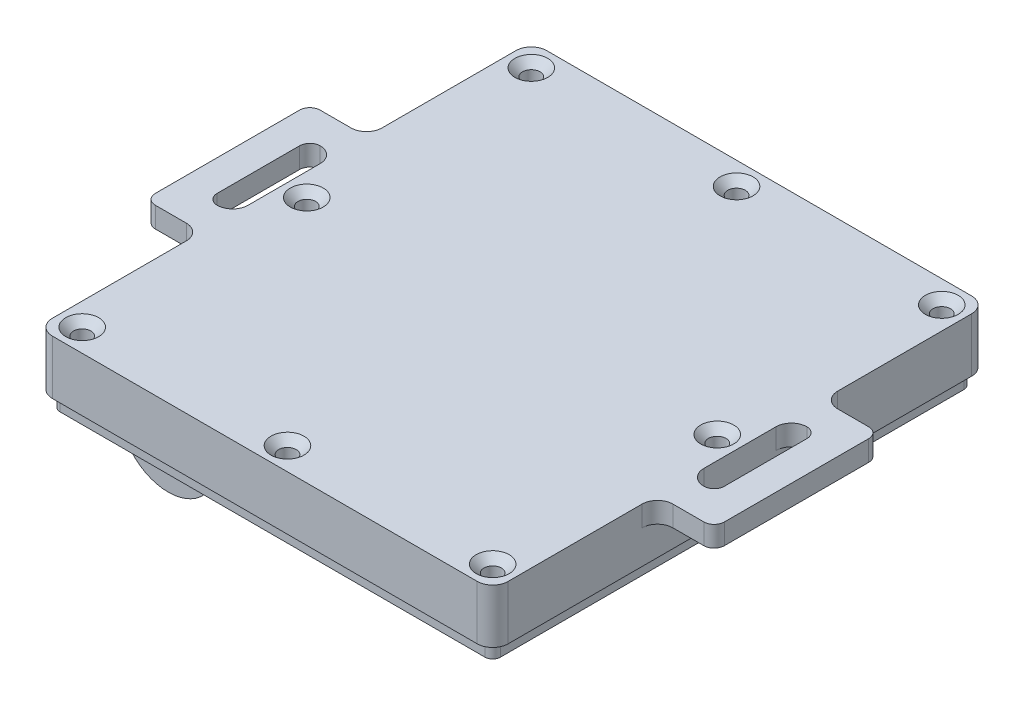
from build123d import *

# Parameters (mm, degrees)
SKETCH_1_W            = 88.5
SKETCH_1_H            = 96
SKETCH_1_W_2          = 51.5
SKETCH_1_H_2          = 70.5
SKETCH_1_W_3          = 19
SKETCH_1_H_3          = 71
EXTRUDE_1_DEPTH       = 9.5
SKETCH_5_W            = 88.5
SKETCH_5_H            = 96
EXTRUDE_4_DEPTH       = 4
SKETCH_6_W            = 51.5
SKETCH_6_H            = 1
EXTRUDE_6_DEPTH       = 4
FILLET_3_R            = 9.5
SKETCH_7_W            = 8
SKETCH_7_H            = 9.5
SKETCH_7_W_2          = 37
SKETCH_7_H_2          = 1.5
CUT_EXTRUDE_1_DEPTH   = 4.5
SKETCH_8_W            = 2.5
SKETCH_8_H            = 30
CUT_EXTRUDE_2_DEPTH   = 5.5
SKETCH_9_W            = 19
SKETCH_9_H            = 4.5
EXTRUDE_7_DEPTH       = 9.5
FILLET_4_R            = 9.5
CUT_EXTRUDE_3_DEPTH   = 2.5
SKETCH_11_R           = 3.75
CUT_EXTRUDE_4_DEPTH   = 2.5
SKETCH_13_R           = 1.7
CUT_EXTRUDE_5_DEPTH   = 73.573120111
SKETCH_14_R           = 1.7
CUT_EXTRUDE_6_DEPTH   = 73.573120111
CHAMFER_1_SIZE        = 1.5
SKETCH_15_W           = 6
SKETCH_15_H           = 71
CUT_EXTRUDE_7_DEPTH   = 9.5
CUT_EXTRUDE_9_REACH   = 82.165
SKETCH_18_W           = 2.9
SKETCH_18_H           = 7.825684219
CUT_EXTRUDE_10_DEPTH  = 2.5
SKETCH_19_W           = 3.75
SKETCH_19_H           = 9.5
CUT_EXTRUDE_11_DEPTH  = 2.5
FILLET_5_R            = 3
CUT_EXTRUDE_2_2_DEPTH = 3
EXTRUDE_8_DEPTH       = 4
FILLET_6_R            = 3


with BuildPart() as part:
    # Эскиз1 → Бобышка-Вытянуть1 (new body)
    with BuildSketch(Plane(origin=(0, 0, 0), x_dir=(1, 0, 0), z_dir=(0, 1, 0))):
        with Locations((-4.541472233, 4)):
            Rectangle(SKETCH_1_W, SKETCH_1_H)
        with Locations((5.958527767, -0.75)):
            Rectangle(SKETCH_1_W_2, SKETCH_1_H_2, mode=Mode.SUBTRACT)
        with Locations((-31.291472233, 4)):
            Rectangle(SKETCH_1_W_3, SKETCH_1_H_3, mode=Mode.SUBTRACT)
    extrude(amount=EXTRUDE_1_DEPTH)

    # Эскиз5 → Бобышка-Вытянуть4 (add)
    with BuildSketch(Plane(origin=(0, 9.5, 0), x_dir=(1, 0, 0), z_dir=(0, 1, 0))):
        with Locations((-4.541472233, 4)):
            Rectangle(SKETCH_5_W, SKETCH_5_H)
    extrude(amount=EXTRUDE_4_DEPTH)

    # Эскиз6 → Бобышка-Вытянуть6 (add)
    with BuildSketch(Plane.XZ.offset(-9.5)):
        with Locations((5.958527767, 35.5)):
            Rectangle(SKETCH_6_W, SKETCH_6_H)
        with Locations((5.958527767, -34)):
            Rectangle(SKETCH_6_W, SKETCH_6_H)
    extrude(amount=EXTRUDE_6_DEPTH)

    # Скругление3
    fillet_3_edges = [part.edges().sort_by_distance(p)[0] for p in [
        (-40.791472233, 9.5, -4),
        (-21.791472233, 9.5, -4),
    ]]
    fillet(fillet_3_edges, radius=FILLET_3_R - 0.0001)  # a hair under: the kernel refuses the full size

    # Эскиз7 → Вырез-Вытянуть1 (cut)
    with BuildSketch(Plane.XZ):
        with Locations((27.708527767, -39.25)):
            Rectangle(SKETCH_7_W, SKETCH_7_H)
        with Locations((-1.291472233, -35.25)):
            Rectangle(SKETCH_7_W_2, SKETCH_7_H_2)
    extrude(amount=-CUT_EXTRUDE_1_DEPTH, mode=Mode.SUBTRACT)

    # Эскиз8 → Cut-Extrude 2 (cut)
    with BuildSketch(Plane.XZ):
        with Locations((32.958527767, 21)):
            Rectangle(SKETCH_8_W, SKETCH_8_H)
    extrude(amount=-CUT_EXTRUDE_2_DEPTH, mode=Mode.SUBTRACT)

    # Эскиз9 → Бобышка-Вытянуть7 (add)
    with BuildSketch(Plane.XZ):
        with Locations((-31.291472233, 33.75)):
            Rectangle(SKETCH_9_W, SKETCH_9_H)
        with Locations((-31.291472233, -41.75)):
            Rectangle(SKETCH_9_W, SKETCH_9_H)
    extrude(amount=EXTRUDE_7_DEPTH)

    # Скругление4
    fillet_4_edges = [part.edges().sort_by_distance(p)[0] for p in [
        (-21.791472233, -9.5, 33.75),
        (-21.791472233, -9.5, -41.75),
        (-40.791472233, -9.5, -41.75),
        (-40.791472233, -9.5, 33.75),
    ]]
    fillet(fillet_4_edges, radius=FILLET_4_R - 0.0001)  # a hair under: the kernel refuses the full size

    # Эскиз10 → Вырез-Вытянуть3 (cut)
    with BuildSketch(Plane(origin=(0, 0, 31.5), x_dir=(-1, 0, 0), z_dir=(0, 0, -1))):
        Polygon((31.291472233, 3.348631561), (28.391472233, 1.674315781), (28.391472233, -1.674315781), (31.291472233, -3.348631561), (34.191472233, -1.674315781), (34.191472233, 1.674315781), align=None)
    extrude(amount=-CUT_EXTRUDE_3_DEPTH, mode=Mode.SUBTRACT)

    # Эскиз11 → Вырез-Вытянуть4 (cut)
    with BuildSketch(Plane.XY.offset(-39.5)):
        with Locations((-31.291472233, 0)):
            Circle(SKETCH_11_R)
    extrude(amount=-CUT_EXTRUDE_4_DEPTH, mode=Mode.SUBTRACT)

    # Эскиз13 → Вырез-Вытянуть5 (cut, through all)
    with BuildSketch(Plane.XZ):
        with Locations(Location((35.308527767, 39.6, 0), (0, 0, 90))):
            Circle(SKETCH_13_R)
        with Locations(Location((-44.391472233, 39.6, 0), (0, 0, 270))):
            Circle(SKETCH_13_R)
        with Locations(Location((-44.391472233, -47.6, 0), (0, 0, 90))):
            Circle(SKETCH_13_R)
        with Locations(Location((35.308527767, -47.6, 0), (0, 0, 270))):
            Circle(SKETCH_13_R)
    extrude(amount=-CUT_EXTRUDE_5_DEPTH, mode=Mode.SUBTRACT)

    # Эскиз14 → Вырез-Вытянуть6 (cut, through all)
    with BuildSketch(Plane.XZ):
        with Locations(Location((-4.541472233, -47.6, 0), (0, 0, 270))):
            Circle(SKETCH_14_R)
        with Locations(Location((-4.541472233, 39.6, 0), (0, 0, 90))):
            Circle(SKETCH_14_R)
        with Locations(Location((-44.391472233, -4, 0), (0, 0, 270))):
            Circle(SKETCH_14_R)
        with Locations(Location((35.308527767, -4, 0), (0, 0, 90))):
            Circle(SKETCH_14_R)
    extrude(amount=-CUT_EXTRUDE_6_DEPTH, mode=Mode.SUBTRACT)

    # Фаска1
    chamfer_1_edges = [part.edges().sort_by_distance(p)[0] for p in [
        (-44.391472233, 13.5, 41.3),
        (35.308527767, 13.5, 37.9),
        (-44.391472233, 13.5, -49.3),
        (35.308527767, 13.5, -45.9),
        (-4.541472233, 13.5, -45.9),
        (-4.541472233, 13.5, 37.9),
        (-44.391472233, 13.5, -2.3),
        (35.308527767, 13.5, -5.7),
    ]]
    chamfer(chamfer_1_edges, length=CHAMFER_1_SIZE)

    # Эскиз15 → Вырез-Вытянуть7 (cut)
    with BuildSketch(Plane.XZ):
        with Locations((-28.291472233, -4)):
            Rectangle(SKETCH_15_W, SKETCH_15_H)
    extrude(amount=-CUT_EXTRUDE_7_DEPTH, mode=Mode.SUBTRACT)

    # Вырез-Вытянуть9: up to this face of the body (flat: up to its plane)
    cut_extrude_9_end = Plane(part.part.faces().sort_by_distance((-25.291472233, 8.432756206, -4))[0])
    # Эскиз17 → Вырез-Вытянуть9 (cut, up to the picked face)
    with BuildSketch(Plane(origin=(-19.791472233, 0, 0), x_dir=(0, 0, -1), z_dir=(1, 0, 0)), mode=Mode.PRIVATE) as cut_extrude_9_sk1:
        with BuildLine():
            Line((-31.5, 9.5), (-26.5, 9.5))
            Line((-26.5, 9.5), (-26.5, 6.283345014))
            ThreePointArc((-26.5, 6.283345014), (-27.085786438, 4.869131452), (-28.5, 4.283345014))
            Line((-28.5, 4.283345014), (-29.5, 4.283345014))
            ThreePointArc((-29.5, 4.283345014), (-30.914213562, 4.869131452), (-31.5, 6.283345014))
            Line((-31.5, 6.283345014), (-31.5, 9.5))
        make_face()
    cut_extrude_9_tool1 = split(extrude(cut_extrude_9_sk1.sketch, amount=-CUT_EXTRUDE_9_REACH, mode=Mode.PRIVATE), bisect_by=cut_extrude_9_end, keep=Keep.BOTH, mode=Mode.PRIVATE)
    add(cut_extrude_9_tool1.solids().sort_by(Axis((-19.791472, 7.043974, 29), (-1, 0, 0)))[0], mode=Mode.SUBTRACT)

    # Эскиз18 → Вырез-Вытянуть10 (cut)
    with BuildSketch(Plane(origin=(0, 0, 31.5), x_dir=(-1, 0, 0), z_dir=(0, 0, -1))):
        with Locations((29.841472233, 5.587157891)):
            Rectangle(SKETCH_18_W, SKETCH_18_H)
    extrude(amount=-CUT_EXTRUDE_10_DEPTH, mode=Mode.SUBTRACT)

    # Эскиз19 → Вырез-Вытянуть11 (cut)
    with BuildSketch(Plane.XY.offset(-39.5)):
        with Locations((-29.416472233, 4.75)):
            Rectangle(SKETCH_19_W, SKETCH_19_H)
    extrude(amount=-CUT_EXTRUDE_11_DEPTH, mode=Mode.SUBTRACT)

    # Скругление5
    fillet_5_edges = [part.edges().sort_by_distance(p)[0] for p in [
        (-48.791472233, 6.75, -52),
        (39.708527767, 6.75, -52),
        (39.708527767, 6.75, 44),
        (-48.791472233, 6.75, 44),
    ]]
    fillet(fillet_5_edges, radius=FILLET_5_R)

    # Эскиз21 → Cut-Extrude 2 2 (cut)
    with BuildSketch(Plane.XZ):
        with BuildLine():
            Line((-48.791472233, -49), (-48.791472233, 41))
            ThreePointArc((-48.791472233, 41), (-47.912792577, 43.121320344), (-45.791472233, 44))
            Line((-45.791472233, 44), (36.708527767, 44))
            ThreePointArc((36.708527767, 44), (38.82984811, 43.121320344), (39.708527767, 41))
            Line((39.708527767, 41), (39.708527767, -49))
            ThreePointArc((39.708527767, -49), (38.82984811, -51.121320344), (36.708527767, -52))
            Line((36.708527767, -52), (-45.791472233, -52))
            ThreePointArc((-45.791472233, -52), (-47.912792577, -51.121320344), (-48.791472233, -49))
        make_face()
        with BuildLine():
            Line((-47.291472233, -49), (-47.291472233, 41))
            ThreePointArc((-47.291472233, 41), (-46.852132405, 42.060660172), (-45.791472233, 42.5))
            Line((-45.791472233, 42.5), (36.708527767, 42.5))
            ThreePointArc((36.708527767, 42.5), (37.769187939, 42.060660172), (38.208527767, 41))
            Line((38.208527767, 41), (38.208527767, -49))
            ThreePointArc((38.208527767, -49), (37.769187939, -50.060660172), (36.708527767, -50.5))
            Line((36.708527767, -50.5), (-45.791472233, -50.5))
            ThreePointArc((-45.791472233, -50.5), (-46.852132405, -50.060660172), (-47.291472233, -49))
        make_face(mode=Mode.SUBTRACT)
    extrude(amount=-CUT_EXTRUDE_2_2_DEPTH, mode=Mode.SUBTRACT)

    # Эскиз22 → Бобышка-Вытянуть8 (add)
    with BuildSketch(Plane(origin=(0, 13.5, 0), x_dir=(1, 0, 0), z_dir=(0, 1, 0))):
        with BuildLine():
            Line((-48.791472233, -6), (-51.791472233, -6))
            ThreePointArc((-51.791472233, -6), (-53.205685795, -5.414213562), (-53.791472233, -4))
            Line((-53.791472233, -4), (-53.791472233, 12))
            ThreePointArc((-53.791472233, 12), (-53.205685795, 13.414213562), (-51.791472233, 14))
            Line((-51.791472233, 14), (-48.791472233, 14))
            Line((-48.791472233, 14), (-48.791472233, 20))
            Line((-48.791472233, 20), (-57.791472233, 20))
            ThreePointArc((-57.791472233, 20), (-59.205685795, 19.414213562), (-59.791472233, 18))
            Line((-59.791472233, 18), (-59.791472233, -10))
            ThreePointArc((-59.791472233, -10), (-59.205685795, -11.414213562), (-57.791472233, -12))
            Line((-57.791472233, -12), (-48.791472233, -12))
            Line((-48.791472233, -12), (-48.791472233, -6))
        make_face()
        with BuildLine():
            Line((39.708527767, -6), (39.708527767, -12))
            Line((39.708527767, -12), (48.708527767, -12))
            ThreePointArc((48.708527767, -12), (50.122741329, -11.414213562), (50.708527767, -10))
            Line((50.708527767, -10), (50.708527767, 18))
            ThreePointArc((50.708527767, 18), (50.122741329, 19.414213562), (48.708527767, 20))
            Line((48.708527767, 20), (39.708527767, 20))
            Line((39.708527767, 20), (39.708527767, 14))
            Line((39.708527767, 14), (42.708527767, 14))
            ThreePointArc((42.708527767, 14), (44.122741329, 13.414213562), (44.708527767, 12))
            Line((44.708527767, 12), (44.708527767, -4))
            ThreePointArc((44.708527767, -4), (44.122741329, -5.414213562), (42.708527767, -6))
            Line((42.708527767, -6), (39.708527767, -6))
        make_face()
    extrude(amount=-EXTRUDE_8_DEPTH)

    # Скругление6
    fillet_6_edges = [part.edges().sort_by_distance(p)[0] for p in [
        (-48.791472233, 11.5, -14),
        (-48.791472233, 11.5, 6),
        (-48.791472233, 11.5, -20),
        (-48.791472233, 11.5, 12),
        (39.708527767, 11.5, 6),
        (39.708527767, 11.5, -14),
        (39.708527767, 11.5, 12),
        (39.708527767, 11.5, -20),
    ]]
    fillet(fillet_6_edges, radius=FILLET_6_R - 0.0001)  # a hair under: the kernel refuses the full size


solid = part.part
